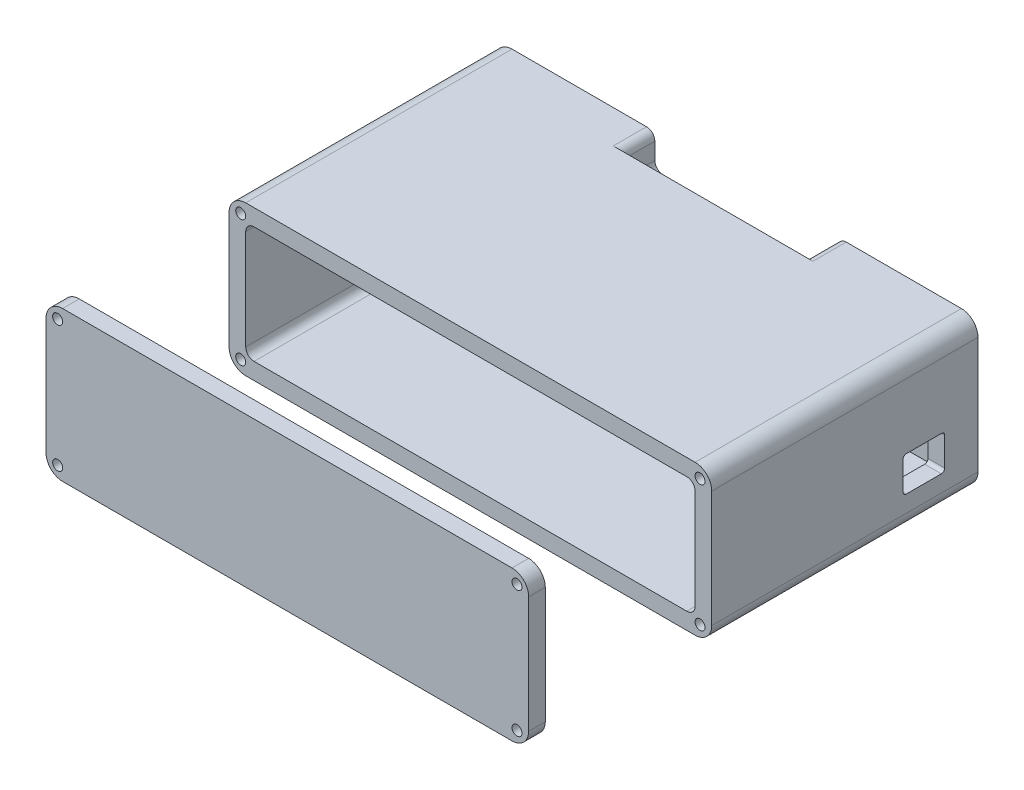
from build123d import *

# Parameters (mm, degrees)
SKETCH1_W           = 145
SKETCH1_H           = 45
BOSS_EXTRUDE1_DEPTH = 80
SKETCH2_W           = 135
SKETCH2_H           = 35
CUT_EXTRUDE1_DEPTH  = 75
SKETCH4_R           = 14
CUT_EXTRUDE4_DEPTH  = 20
SKETCH8_W           = 55
SKETCH8_H           = 10
CUT_EXTRUDE7_DEPTH  = 10
FILLET4_R           = 5
FILLET5_R           = 2.5
SKETCH9_R           = 1.5
CUT_EXTRUDE8_DEPTH  = 10
SKETCH10_W          = 12.5
SKETCH10_H          = 10.5
CUT_EXTRUDE9_DEPTH  = 5
FILLET11_R          = 1
FILLET13_R          = 2.5
SKETCH11_R          = 1.5
CUT_EXTRUDE10_DEPTH = 5
SKETCH12_W          = 145
SKETCH12_H          = 45
BOSS_EXTRUDE2_DEPTH = 5
FILLET14_R          = 5
SKETCH13_R          = 1.5
CUT_EXTRUDE11_DEPTH = 5


with BuildPart() as part:
    # Sketch1 → Boss-Extrude1 (new body)
    with BuildSketch(Plane.XY):
        with Locations((72.5, -22.5)):
            Rectangle(SKETCH1_W, SKETCH1_H)
    extrude(amount=BOSS_EXTRUDE1_DEPTH)

    # Sketch2 → Cut-Extrude1 (cut)
    with BuildSketch(Plane.XY.offset(80)):
        with Locations((72.5, -22.5)):
            Rectangle(SKETCH2_W, SKETCH2_H)
    extrude(amount=-CUT_EXTRUDE1_DEPTH, mode=Mode.SUBTRACT)

    # Sketch4 → Cut-Extrude4 (cut)
    with BuildSketch(Plane.XY.offset(5)):
        with Locations((22.5, -24.5)):
            Circle(SKETCH4_R)
    extrude(amount=-CUT_EXTRUDE4_DEPTH, mode=Mode.SUBTRACT)

    # Sketch8 → Cut-Extrude7 (cut)
    with BuildSketch(Plane(origin=(0, 0, 0), x_dir=(-1, 0, 0), z_dir=(0, 0, -1))):
        with Locations((-75.408439327, -5)):
            Rectangle(SKETCH8_W, SKETCH8_H)
    extrude(amount=-CUT_EXTRUDE7_DEPTH, mode=Mode.SUBTRACT)

    # Fillet4
    fillet4_edges = [part.edges().sort_by_distance(p)[0] for p in [
        (145, -45, 40),
        (145, 0, 40),
        (0, -45, 40),
        (0, 0, 40),
    ]]
    fillet(fillet4_edges, radius=FILLET4_R)

    # Fillet5
    fillet5_edges = [part.edges().sort_by_distance(p)[0] for p in [
        (140, -40, 42.5),
        (140, -5, 42.5),
        (5, -40, 42.5),
        (5, -5, 42.5),
    ]]
    fillet(fillet5_edges, radius=FILLET5_R)

    # Sketch9 → Cut-Extrude8 (cut)
    with BuildSketch(Plane.XY.offset(80)):
        with Locations((3.5, -3.5)):
            Circle(SKETCH9_R)
        with Locations((141.5, -3.5)):
            Circle(SKETCH9_R)
        with Locations((141.5, -41.5)):
            Circle(SKETCH9_R)
        with Locations((3.5, -41.5)):
            Circle(SKETCH9_R)
    extrude(amount=-CUT_EXTRUDE8_DEPTH, mode=Mode.SUBTRACT)

    # Sketch10 → Cut-Extrude9 (cut)
    with BuildSketch(Plane.ZY.offset(-140)):
        with Locations((16.25, -29.75)):
            Rectangle(SKETCH10_W, SKETCH10_H)
    extrude(amount=-CUT_EXTRUDE9_DEPTH, mode=Mode.SUBTRACT)

    # Fillet11
    fillet11_edges = [part.edges().sort_by_distance(p)[0] for p in [
        (142.5, -35, 10),
        (142.5, -35, 22.5),
        (142.5, -24.5, 22.5),
        (142.5, -24.5, 10),
    ]]
    fillet(fillet11_edges, radius=FILLET11_R)

    # Fillet13
    fillet13_edges = [part.edges().sort_by_distance(p)[0] for p in [
        (102.908439327, 0, 5),
        (47.908439327, 0, 5),
        (47.908439327, -10, 2.5),
        (102.908439327, -10, 2.5),
    ]]
    fillet(fillet13_edges, radius=FILLET13_R)

    # Sketch11 → Cut-Extrude10 (cut)
    with BuildSketch(Plane.XY.offset(5)):
        with Locations((8, -11.25621354)):
            Circle(SKETCH11_R)
        with Locations((8, -37)):
            Circle(SKETCH11_R)
    extrude(amount=-CUT_EXTRUDE10_DEPTH, mode=Mode.SUBTRACT)


with BuildPart() as body_2:
    # Sketch12 → Boss-Extrude2 (new body)
    with BuildSketch(Plane.XY.offset(130)):
        with Locations((72.5, -22.5)):
            Rectangle(SKETCH12_W, SKETCH12_H)
    extrude(amount=BOSS_EXTRUDE2_DEPTH)

    # Fillet14
    fillet14_edges = [body_2.edges().sort_by_distance(p)[0] for p in [
        (145, -45, 132.5),
        (145, 0, 132.5),
        (0, -45, 132.5),
        (0, 0, 132.5),
    ]]
    fillet(fillet14_edges, radius=FILLET14_R)

    # Sketch13 → Cut-Extrude11 (cut)
    with BuildSketch(Plane.XY.offset(135)):
        with Locations((3.5, -3.5)):
            Circle(SKETCH13_R)
        with Locations((141.5, -3.5)):
            Circle(SKETCH13_R)
        with Locations((141.5, -41.5)):
            Circle(SKETCH13_R)
        with Locations((3.5, -41.5)):
            Circle(SKETCH13_R)
    extrude(amount=-CUT_EXTRUDE11_DEPTH, mode=Mode.SUBTRACT)


solid = Compound([part.part, body_2.part])
